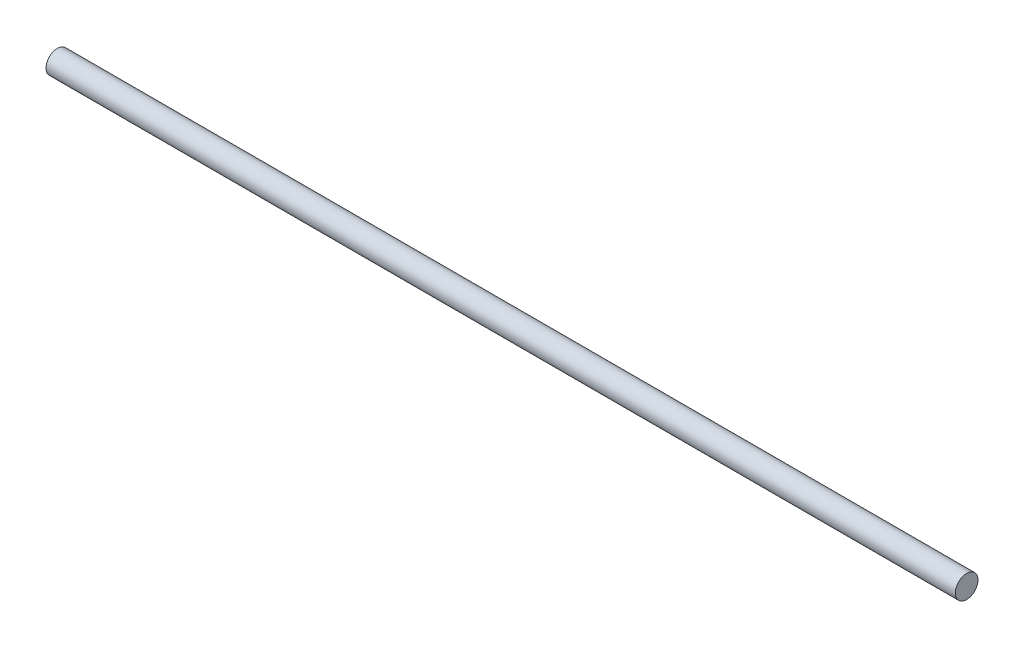
from build123d import *

# Parameters (mm, degrees)
SKETCH4_R           = 3.81
BOSS_EXTRUDE2_DEPTH = 304.8


with BuildPart() as part:
    # Sketch4 → Boss-Extrude2 (new body)
    with BuildSketch(Plane(origin=(0, 0, 0), x_dir=(0, 0, -1), z_dir=(1, 0, 0))):
        with Locations((57.673059582, 144.175869708)):
            Circle(SKETCH4_R)
    extrude(amount=BOSS_EXTRUDE2_DEPTH)


solid = part.part
